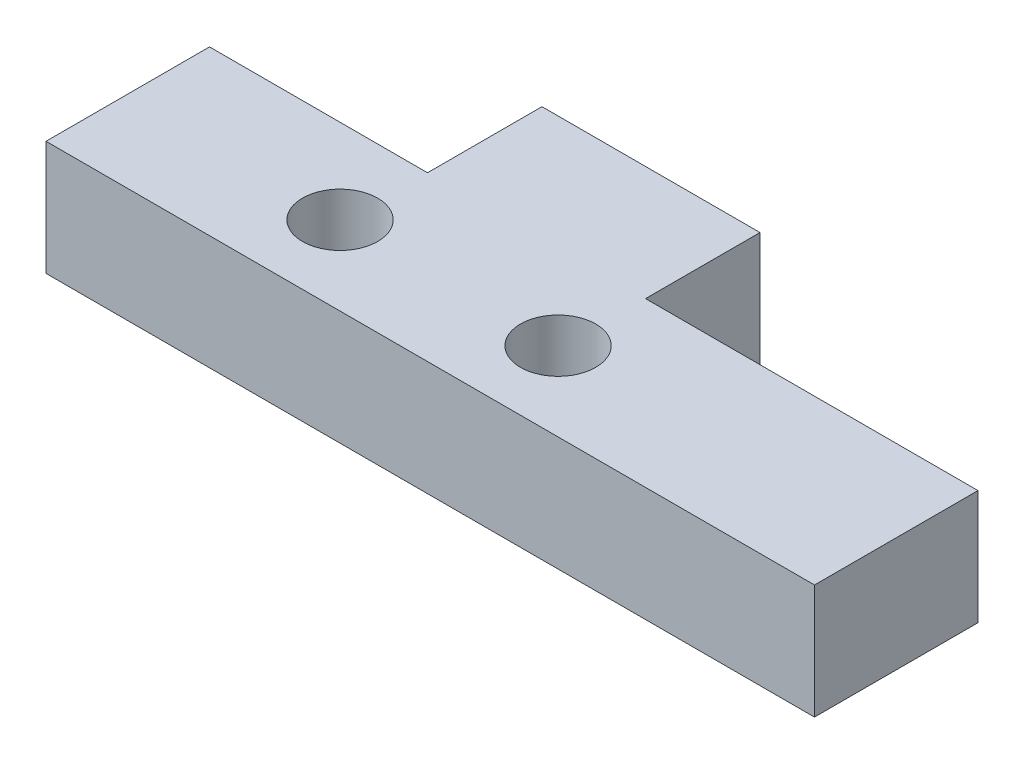
from build123d import *

# Parameters (mm, degrees)
SKETCH1_W           = 30.48
SKETCH1_H           = 7.62
BOSS_EXTRUDE1_DEPTH = 2.667
SKETCH2_W           = 10.16
SKETCH2_H           = 5.334
BOSS_EXTRUDE2_DEPTH = 5.334
SKETCH3_W           = 5.334
SKETCH3_H           = 7.62
BOSS_EXTRUDE3_DEPTH = 5.334
SKETCH6_R           = 1.7526
CUT_EXTRUDE1_DEPTH  = 24.137713111


with BuildPart() as part:
    # Sketch1 → Boss-Extrude1 (new, symmetric)
    with BuildSketch(Plane(origin=(0, 0, 0), x_dir=(1, 0, 0), z_dir=(0, 1, 0))):
        Rectangle(SKETCH1_W, SKETCH1_H)
    extrude(amount=BOSS_EXTRUDE1_DEPTH, both=True)

    # Sketch2 → Boss-Extrude2 (add)
    with BuildSketch(Plane(origin=(0, 2.667, 0), x_dir=(1, 0, 0), z_dir=(0, 1, 0))):
        with Locations((0, 6.477)):
            Rectangle(SKETCH2_W, SKETCH2_H)
    extrude(amount=-BOSS_EXTRUDE2_DEPTH)

    # Sketch3 → Boss-Extrude3 (add)
    with BuildSketch(Plane(origin=(0, 2.667, 0), x_dir=(1, 0, 0), z_dir=(0, 1, 0))):
        with Locations((17.907, 0)):
            Rectangle(SKETCH3_W, SKETCH3_H)
    extrude(amount=-BOSS_EXTRUDE3_DEPTH)

    # Sketch6 → Cut-Extrude1 (cut, through all)
    with BuildSketch(Plane.XZ.offset(2.667)):
        with Locations((4.941550795, 0.127)):
            Circle(SKETCH6_R)
        with Locations((-5.218449205, 0.127)):
            Circle(SKETCH6_R)
    extrude(amount=-CUT_EXTRUDE1_DEPTH, mode=Mode.SUBTRACT)


solid = part.part
